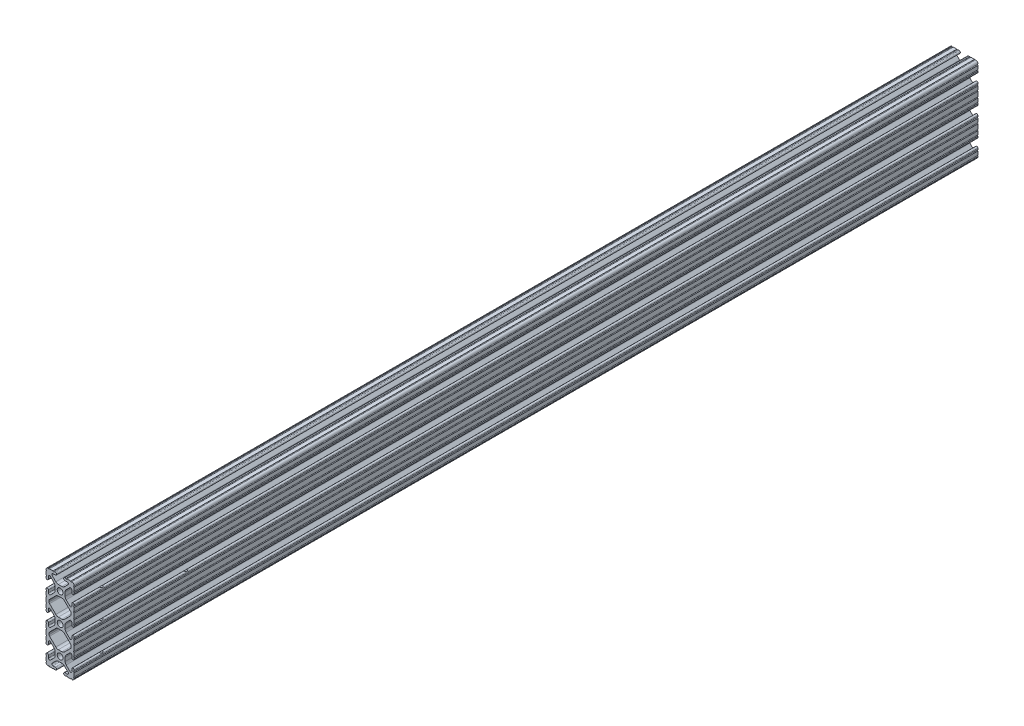
from build123d import *

# Parameters (mm, degrees)
SKETCH1_R               = 2.6035
BOSS_EXTRUDE1_DEPTH     = 406.4
CUT_EXTRUDE1_DEPTH      = 409.544636002
CUT_EXTRUDE1_DEPTH_BACK = 409.544636002
SKETCH2_R               = 3.5
CUT_EXTRUDE2_DEPTH      = 409.544636102
CUT_EXTRUDE2_DEPTH_BACK = 409.544636102
SKETCH3_R               = 3.5


with BuildPart() as part:
    # Sketch1 → Boss-Extrude1 (new, symmetric)
    with BuildSketch(Plane.XY):
        with BuildLine():
            Line((-12.7, 34.9504), (-12.7, 31.7246))
            ThreePointArc((-12.7, 31.7246), (-12.192, 31.2166), (-12.7, 30.7086))
            Line((-12.7, 30.7086), (-12.7, 29.702307889))
            ThreePointArc((-12.7, 29.702307889), (-11.5951, 28.597407889), (-10.4902, 29.702307889))
            Line((-10.4902, 29.702307889), (-10.4902, 31.874794456))
            ThreePointArc((-10.4902, 31.874794456), (-9.863006367, 32.813456061), (-8.75577951, 32.593214945))
            Line((-8.75577951, 32.593214945), (-5.43843597, 29.275871405))
            ThreePointArc((-5.43843597, 29.275871405), (-4.750182484, 28.245827272), (-4.5085, 27.030807374))
            Line((-4.5085, 27.030807374), (-4.5085, 23.769192626))
            ThreePointArc((-4.5085, 23.769192626), (-4.750182484, 22.554172728), (-5.43843597, 21.524128595))
            Line((-5.43843597, 21.524128595), (-8.75577951, 18.206785055))
            ThreePointArc((-8.75577951, 18.206785055), (-9.863006367, 17.986543939), (-10.4902, 18.925205544))
            Line((-10.4902, 18.925205544), (-10.4902, 21.097692111))
            ThreePointArc((-10.4902, 21.097692111), (-11.5951, 22.202592111), (-12.7, 21.097692111))
            Line((-12.7, 21.097692111), (-12.7, 20.0914))
            ThreePointArc((-12.7, 20.0914), (-12.192, 19.5834), (-12.7, 19.0754))
            Line((-12.7, 19.0754), (-12.7, 15.8496))
            ThreePointArc((-12.7, 15.8496), (-12.192, 15.3416), (-12.7, 14.8336))
            Line((-12.7, 14.8336), (-12.7, 10.5664))
            ThreePointArc((-12.7, 10.5664), (-12.192, 10.0584), (-12.7, 9.5504))
            Line((-12.7, 9.5504), (-12.7, 6.3246))
            ThreePointArc((-12.7, 6.3246), (-12.192000017, 5.8166), (-12.7, 5.3086))
            Line((-12.7, 5.3086), (-12.7, 4.302307889))
            ThreePointArc((-12.7, 4.302307889), (-11.5951, 3.197407889), (-10.4902, 4.302307889))
            Line((-10.4902, 4.302307889), (-10.4902, 6.474794456))
            ThreePointArc((-10.4902, 6.474794456), (-9.863006367, 7.413456061), (-8.75577951, 7.193214945))
            Line((-8.75577951, 7.193214945), (-5.43843597, 3.875871405))
            ThreePointArc((-5.43843597, 3.875871405), (-4.750182484, 2.845827272), (-4.5085, 1.630807374))
            Line((-4.5085, 1.630807374), (-4.5085, -1.630807374))
            ThreePointArc((-4.5085, -1.630807374), (-4.750182484, -2.845827272), (-5.43843597, -3.875871405))
            Line((-5.43843597, -3.875871405), (-8.75577951, -7.193214945))
            ThreePointArc((-8.75577951, -7.193214945), (-9.863006367, -7.413456061), (-10.4902, -6.474794456))
            Line((-10.4902, -6.474794456), (-10.4902, -4.302307889))
            ThreePointArc((-10.4902, -4.302307889), (-11.5951, -3.197407889), (-12.7, -4.302307889))
            Line((-12.7, -4.302307889), (-12.7, -5.3086))
            ThreePointArc((-12.7, -5.3086), (-12.191999983, -5.8166), (-12.7, -6.3246))
            Line((-12.7, -6.3246), (-12.7, -9.5504))
            ThreePointArc((-12.7, -9.5504), (-12.192, -10.0584), (-12.7, -10.5664))
            Line((-12.7, -10.5664), (-12.7, -14.8336))
            ThreePointArc((-12.7, -14.8336), (-12.192, -15.3416), (-12.7, -15.8496))
            Line((-12.7, -15.8496), (-12.7, -19.0754))
            ThreePointArc((-12.7, -19.0754), (-12.192, -19.5834), (-12.7, -20.0914))
            Line((-12.7, -20.0914), (-12.7, -21.097692111))
            ThreePointArc((-12.7, -21.097692111), (-11.5951, -22.202592111), (-10.4902, -21.097692111))
            Line((-10.4902, -21.097692111), (-10.4902, -18.925205544))
            ThreePointArc((-10.4902, -18.925205544), (-9.863006367, -17.986543939), (-8.75577951, -18.206785055))
            Line((-8.75577951, -18.206785055), (-5.43843597, -21.524128595))
            ThreePointArc((-5.43843597, -21.524128595), (-4.750182484, -22.554172728), (-4.5085, -23.769192626))
            Line((-4.5085, -23.769192626), (-4.5085, -27.030807374))
            ThreePointArc((-4.5085, -27.030807374), (-4.750182484, -28.245827272), (-5.43843597, -29.275871405))
            Line((-5.43843597, -29.275871405), (-8.75577951, -32.593214945))
            ThreePointArc((-8.75577951, -32.593214945), (-9.863006367, -32.813456061), (-10.4902, -31.874794456))
            Line((-10.4902, -31.874794456), (-10.4902, -29.702307889))
            ThreePointArc((-10.4902, -29.702307889), (-11.5951, -28.597407889), (-12.7, -29.702307889))
            Line((-12.7, -29.702307889), (-12.7, -30.7086))
            ThreePointArc((-12.7, -30.7086), (-12.192, -31.2166), (-12.7, -31.7246))
            Line((-12.7, -31.7246), (-12.7, -34.9504))
            ThreePointArc((-12.7, -34.9504), (-12.192, -35.4584), (-12.7, -35.9664))
            ThreePointArc((-12.7, -35.9664), (-12.082677406, -37.482677406), (-10.5664, -38.1))
            ThreePointArc((-10.5664, -38.1), (-10.0584, -37.592), (-9.5504, -38.1))
            Line((-9.5504, -38.1), (-6.3246, -38.1))
            ThreePointArc((-6.3246, -38.1), (-5.816599996, -37.592000017), (-5.3086, -38.100000008))
            Line((-5.3086, -38.100000008), (-4.302307889, -38.100000008))
            ThreePointArc((-4.302307889, -38.100000008), (-3.197407889, -36.995100008), (-4.302307889, -35.890200008))
            Line((-4.302307889, -35.890200008), (-6.474794456, -35.890200008))
            ThreePointArc((-6.474794456, -35.890200008), (-7.413456061, -35.263006376), (-7.193214945, -34.155779519))
            Line((-7.193214945, -34.155779519), (-3.875871405, -30.838435978))
            ThreePointArc((-3.875871405, -30.838435978), (-2.845827272, -30.150182493), (-1.630807374, -29.908500008))
            Line((-1.630807374, -29.908500008), (1.630807374, -29.908500008))
            ThreePointArc((1.630807374, -29.908500008), (2.845827272, -30.150182493), (3.875871405, -30.838435978))
            Line((3.875871405, -30.838435978), (7.193214945, -34.155779519))
            ThreePointArc((7.193214945, -34.155779519), (7.413456061, -35.263006376), (6.474794456, -35.890200008))
            Line((6.474794456, -35.890200008), (4.302307889, -35.890200008))
            ThreePointArc((4.302307889, -35.890200008), (3.197407889, -36.995100008), (4.302307889, -38.100000008))
            Line((4.302307889, -38.100000008), (5.3086, -38.100000008))
            ThreePointArc((5.3086, -38.100000008), (5.8166, -37.591999992), (6.3246, -38.100000008))
            Line((6.3246, -38.100000008), (9.5504, -38.100000008))
            ThreePointArc((9.5504, -38.100000008), (10.0584, -37.592000008), (10.5664, -38.100000008))
            ThreePointArc((10.5664, -38.100000008), (12.082677406, -37.482677414), (12.7, -35.966400008))
            ThreePointArc((12.7, -35.966400008), (12.192, -35.458400008), (12.7, -34.950400008))
            Line((12.7, -34.950400008), (12.7, -31.724600008))
            ThreePointArc((12.7, -31.724600008), (12.192, -31.216600008), (12.7, -30.708600008))
            Line((12.7, -30.708600008), (12.7, -29.702307926))
            ThreePointArc((12.7, -29.702307926), (11.5951, -28.597407926), (10.4902, -29.702307926))
            Line((10.4902, -29.702307926), (10.4902, -31.874794464))
            ThreePointArc((10.4902, -31.874794464), (9.863006367, -32.813456069), (8.75577951, -32.593214954))
            Line((8.75577951, -32.593214954), (5.43843597, -29.275871413))
            ThreePointArc((5.43843597, -29.275871413), (4.750182484, -28.245827281), (4.5085, -27.030807383))
            Line((4.5085, -27.030807383), (4.5085, -23.769192634))
            ThreePointArc((4.5085, -23.769192634), (4.750182484, -22.554172736), (5.43843597, -21.524128604))
            Line((5.43843597, -21.524128604), (8.75577951, -18.206785063))
            ThreePointArc((8.75577951, -18.206785063), (9.863006367, -17.986543948), (10.4902, -18.925205553))
            Line((10.4902, -18.925205553), (10.4902, -21.097692067))
            ThreePointArc((10.4902, -21.097692067), (11.5951, -22.202592067), (12.7, -21.097692067))
            Line((12.7, -21.097692067), (12.7, -20.091400008))
            ThreePointArc((12.7, -20.091400008), (12.192, -19.583400008), (12.7, -19.075400008))
            Line((12.7, -19.075400008), (12.7, -15.849600008))
            ThreePointArc((12.7, -15.849600008), (12.192, -15.341600008), (12.7, -14.833600008))
            Line((12.7, -14.833600008), (12.7, -10.566400008))
            ThreePointArc((12.7, -10.566400008), (12.192, -10.058400008), (12.7, -9.550400008))
            Line((12.7, -9.550400008), (12.7, -6.324600008))
            ThreePointArc((12.7, -6.324600008), (12.192000017, -5.816600008), (12.7, -5.308600008))
            Line((12.7, -5.308600008), (12.7, -4.302307897))
            ThreePointArc((12.7, -4.302307897), (11.5951, -3.197407897), (10.4902, -4.302307897))
            Line((10.4902, -4.302307897), (10.4902, -6.474794464))
            ThreePointArc((10.4902, -6.474794464), (9.863006367, -7.413456069), (8.75577951, -7.193214954))
            Line((8.75577951, -7.193214954), (5.43843597, -3.875871413))
            ThreePointArc((5.43843597, -3.875871413), (4.750182484, -2.845827281), (4.5085, -1.630807383))
            Line((4.5085, -1.630807383), (4.5085, 1.630807366))
            ThreePointArc((4.5085, 1.630807366), (4.750182484, 2.845827264), (5.43843597, 3.875871396))
            Line((5.43843597, 3.875871396), (8.75577951, 7.193214937))
            ThreePointArc((8.75577951, 7.193214937), (9.863006367, 7.413456052), (10.4902, 6.474794447))
            Line((10.4902, 6.474794447), (10.4902, 4.302307881))
            ThreePointArc((10.4902, 4.302307881), (11.5951, 3.197407881), (12.7, 4.302307881))
            Line((12.7, 4.302307881), (12.7, 5.308599992))
            ThreePointArc((12.7, 5.308599992), (12.191999983, 5.816599992), (12.7, 6.324599992))
            Line((12.7, 6.324599992), (12.7, 9.550399992))
            ThreePointArc((12.7, 9.550399992), (12.192, 10.058399992), (12.7, 10.566399992))
            Line((12.7, 10.566399992), (12.7, 14.833599992))
            ThreePointArc((12.7, 14.833599992), (12.192, 15.341599992), (12.7, 15.849599992))
            Line((12.7, 15.849599992), (12.7, 19.075399992))
            ThreePointArc((12.7, 19.075399992), (12.192, 19.583399992), (12.7, 20.091399992))
            Line((12.7, 20.091399992), (12.7, 21.097692074))
            ThreePointArc((12.7, 21.097692074), (11.5951, 22.202592074), (10.4902, 21.097692074))
            Line((10.4902, 21.097692074), (10.4902, 18.925205536))
            ThreePointArc((10.4902, 18.925205536), (9.863006367, 17.986543931), (8.75577951, 18.206785046))
            Line((8.75577951, 18.206785046), (5.43843597, 21.524128587))
            ThreePointArc((5.43843597, 21.524128587), (4.750182484, 22.554172719), (4.5085, 23.769192617))
            Line((4.5085, 23.769192617), (4.5085, 27.030807366))
            ThreePointArc((4.5085, 27.030807366), (4.750182484, 28.245827264), (5.43843597, 29.275871396))
            Line((5.43843597, 29.275871396), (8.75577951, 32.593214937))
            ThreePointArc((8.75577951, 32.593214937), (9.863006367, 32.813456052), (10.4902, 31.874794447))
            Line((10.4902, 31.874794447), (10.4902, 29.702307881))
            ThreePointArc((10.4902, 29.702307881), (11.5951, 28.597407881), (12.7, 29.702307881))
            Line((12.7, 29.702307881), (12.7, 30.708599992))
            ThreePointArc((12.7, 30.708599992), (12.192, 31.216599992), (12.7, 31.724599992))
            Line((12.7, 31.724599992), (12.7, 34.9504))
            ThreePointArc((12.7, 34.9504), (12.192, 35.4584), (12.7, 35.9664))
            ThreePointArc((12.7, 35.9664), (12.082677406, 37.482677406), (10.5664, 38.1))
            ThreePointArc((10.5664, 38.1), (10.0584, 37.592), (9.5504, 38.1))
            Line((9.5504, 38.1), (6.3246, 38.1))
            ThreePointArc((6.3246, 38.1), (5.8166, 37.591999983), (5.3086, 38.1))
            Line((5.3086, 38.1), (4.302307889, 38.1))
            ThreePointArc((4.302307889, 38.1), (3.197407889, 36.9951), (4.302307889, 35.8902))
            Line((4.302307889, 35.8902), (6.474794456, 35.8902))
            ThreePointArc((6.474794456, 35.8902), (7.413456061, 35.263006367), (7.193214945, 34.15577951))
            Line((7.193214945, 34.15577951), (3.875871405, 30.83843597))
            ThreePointArc((3.875871405, 30.83843597), (2.845827272, 30.150182484), (1.630807374, 29.9085))
            Line((1.630807374, 29.9085), (-1.630807374, 29.9085))
            ThreePointArc((-1.630807374, 29.9085), (-2.845827272, 30.150182484), (-3.875871405, 30.83843597))
            Line((-3.875871405, 30.83843597), (-7.193214945, 34.15577951))
            ThreePointArc((-7.193214945, 34.15577951), (-7.413456061, 35.263006367), (-6.474794456, 35.8902))
            Line((-6.474794456, 35.8902), (-4.302307889, 35.8902))
            ThreePointArc((-4.302307889, 35.8902), (-3.197407889, 36.9951), (-4.302307889, 38.1))
            Line((-4.302307889, 38.1), (-5.3086, 38.1))
            ThreePointArc((-5.3086, 38.1), (-5.8166, 37.592000017), (-6.3246, 38.1))
            Line((-6.3246, 38.1), (-9.5504, 38.1))
            ThreePointArc((-9.5504, 38.1), (-10.0584, 37.592), (-10.5664, 38.1))
            ThreePointArc((-10.5664, 38.1), (-12.082677406, 37.482677406), (-12.7, 35.9664))
            ThreePointArc((-12.7, 35.9664), (-12.192, 35.4584), (-12.7, 34.9504))
        make_face()
        with Locations((0, -25.4)):
            Circle(SKETCH1_R, mode=Mode.SUBTRACT)
        Circle(SKETCH1_R, mode=Mode.SUBTRACT)
        with Locations((0, 25.4)):
            Circle(SKETCH1_R, mode=Mode.SUBTRACT)
        with BuildLine():
            Line((-9.9314, -12.146268083), (-9.9314, -13.253731917))
            ThreePointArc((-9.9314, -13.253731917), (-9.811525488, -13.856381786), (-9.470151759, -14.367283676))
            Line((-9.470151759, -14.367283676), (-3.875871405, -19.96156403))
            ThreePointArc((-3.875871405, -19.96156403), (-2.845827272, -20.649817516), (-1.630807374, -20.8915))
            Line((-1.630807374, -20.8915), (1.630807374, -20.8915))
            ThreePointArc((1.630807374, -20.8915), (2.845827272, -20.649817516), (3.875871405, -19.96156403))
            Line((3.875871405, -19.96156403), (9.470151759, -14.367283676))
            ThreePointArc((9.470151759, -14.367283676), (9.811525488, -13.856381786), (9.9314, -13.253731917))
            Line((9.9314, -13.253731917), (9.9314, -12.146268083))
            ThreePointArc((9.9314, -12.146268083), (9.811525488, -11.543618214), (9.470151759, -11.032716324))
            Line((9.470151759, -11.032716324), (3.875871405, -5.43843597))
            ThreePointArc((3.875871405, -5.43843597), (2.845827272, -4.750182484), (1.630807374, -4.5085))
            Line((1.630807374, -4.5085), (-1.630807374, -4.5085))
            ThreePointArc((-1.630807374, -4.5085), (-2.845827272, -4.750182484), (-3.875871405, -5.43843597))
            Line((-3.875871405, -5.43843597), (-9.470151759, -11.032716324))
            ThreePointArc((-9.470151759, -11.032716324), (-9.811525488, -11.543618214), (-9.9314, -12.146268083))
        make_face(mode=Mode.SUBTRACT)
        with BuildLine():
            Line((-9.9314, 13.253731917), (-9.9314, 12.146268083))
            ThreePointArc((-9.9314, 12.146268083), (-9.811525488, 11.543618214), (-9.470151759, 11.032716324))
            Line((-9.470151759, 11.032716324), (-3.875871405, 5.43843597))
            ThreePointArc((-3.875871405, 5.43843597), (-2.845827272, 4.750182484), (-1.630807374, 4.5085))
            Line((-1.630807374, 4.5085), (1.630807374, 4.5085))
            ThreePointArc((1.630807374, 4.5085), (2.845827272, 4.750182484), (3.875871405, 5.43843597))
            Line((3.875871405, 5.43843597), (9.470151759, 11.032716324))
            ThreePointArc((9.470151759, 11.032716324), (9.811525488, 11.543618214), (9.9314, 12.146268083))
            Line((9.9314, 12.146268083), (9.9314, 13.253731917))
            ThreePointArc((9.9314, 13.253731917), (9.811525488, 13.856381786), (9.470151759, 14.367283676))
            Line((9.470151759, 14.367283676), (3.875871405, 19.96156403))
            ThreePointArc((3.875871405, 19.96156403), (2.845827272, 20.649817516), (1.630807374, 20.8915))
            Line((1.630807374, 20.8915), (-1.630807374, 20.8915))
            ThreePointArc((-1.630807374, 20.8915), (-2.845827272, 20.649817516), (-3.875871405, 19.96156403))
            Line((-3.875871405, 19.96156403), (-9.470151759, 14.367283676))
            ThreePointArc((-9.470151759, 14.367283676), (-9.811525488, 13.856381786), (-9.9314, 13.253731917))
        make_face(mode=Mode.SUBTRACT)
    extrude(amount=BOSS_EXTRUDE1_DEPTH, both=True)

    # Sketch2 → Cut-Extrude1 (cut, two sides: drawn at the far end of the back side and taken through both)
    with BuildSketch(Plane(origin=(4.5085, 0, 0), x_dir=(0, 0, -1), z_dir=(1, 0, 0)).offset(-CUT_EXTRUDE1_DEPTH_BACK)):
        with Locations((-381, 25.4)):
            Circle(SKETCH2_R)
        with Locations((-381, 0)):
            Circle(SKETCH2_R)
        with Locations((-381, -25.4)):
            Circle(SKETCH2_R)
    extrude(amount=CUT_EXTRUDE1_DEPTH + CUT_EXTRUDE1_DEPTH_BACK, mode=Mode.SUBTRACT)

    # Sketch3 → Cut-Extrude2 (cut, two sides: drawn at the far end of the back side and taken through both)
    with BuildSketch(Plane(origin=(4.5085, 0, 0), x_dir=(0, 0, -1), z_dir=(1, 0, 0)).offset(-CUT_EXTRUDE2_DEPTH_BACK)):
        with Locations((-304.8, 0)):
            Circle(SKETCH3_R)
    extrude(amount=CUT_EXTRUDE2_DEPTH + CUT_EXTRUDE2_DEPTH_BACK, mode=Mode.SUBTRACT)


solid = part.part
